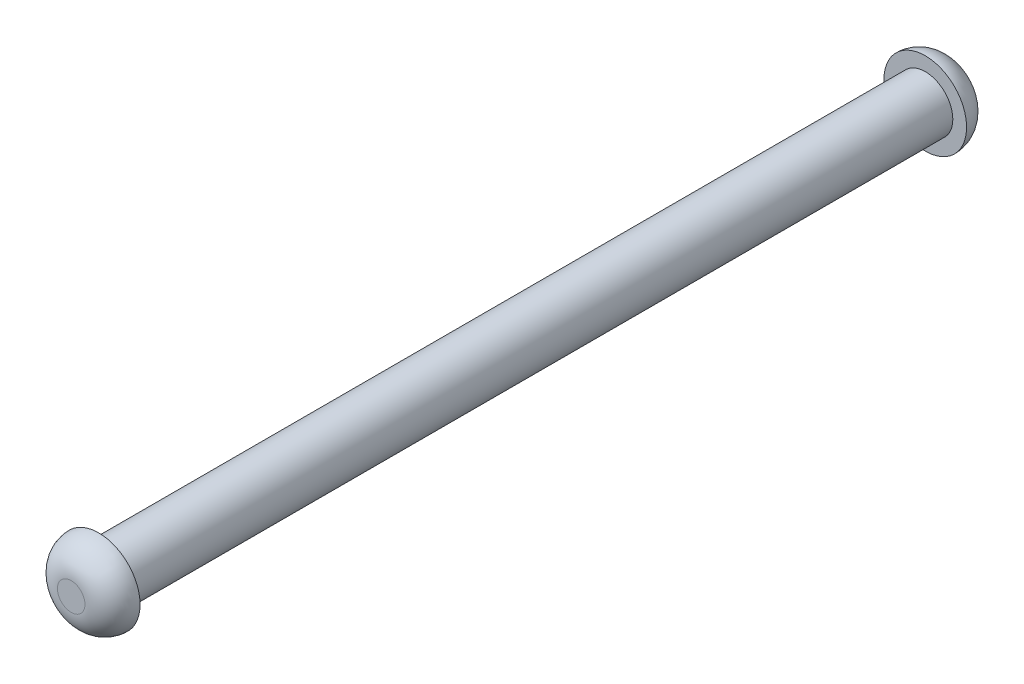
from build123d import *

# Parameters (mm, degrees)
IZIM1_R                     = 5
Y_KSEKLIK_EKSTR_ZYON1_DEPTH = 150
IZIM2_R                     = 7.5
Y_KSEKLIK_EKSTR_ZYON2_DEPTH = 5
RADYUS5_R                   = 5
Y_KSEKLIK_EKSTR_ZYON3_START = 5
IZIM3_R                     = 7.5
Y_KSEKLIK_EKSTR_ZYON3_DEPTH = 5
RADYUS6_R                   = 5


with BuildPart() as part:
    # Çizim1 → Yükseklik-Ekstrüzyon1 (new body)
    with BuildSketch(Plane.XY):
        Circle(IZIM1_R)
    extrude(amount=Y_KSEKLIK_EKSTR_ZYON1_DEPTH)

    # Çizim2 → Yükseklik-Ekstrüzyon2 (add)
    with BuildSketch(Plane.XY.offset(150)):
        Circle(IZIM2_R)
    extrude(amount=Y_KSEKLIK_EKSTR_ZYON2_DEPTH)

    # Radyus5
    radyus5_edges = [part.edges().sort_by_distance(p)[0] for p in [
        (-7.5, 0, 155),
    ]]
    fillet(radyus5_edges, radius=RADYUS5_R - 0.0001)  # a hair under: the kernel refuses the full size

    # Çizim3 → Yükseklik-Ekstrüzyon3 (add)
    with BuildSketch(Plane(origin=(0, 0, 0), x_dir=(-1, 0, 0), z_dir=(0, 0, -1)).offset(Y_KSEKLIK_EKSTR_ZYON3_START)):
        Circle(IZIM3_R)
    extrude(amount=-Y_KSEKLIK_EKSTR_ZYON3_DEPTH)

    # Radyus6
    radyus6_edges = [part.edges().sort_by_distance(p)[0] for p in [
        (7.5, 0, -5),
    ]]
    fillet(radyus6_edges, radius=RADYUS6_R - 0.0001)  # a hair under: the kernel refuses the full size


solid = part.part
